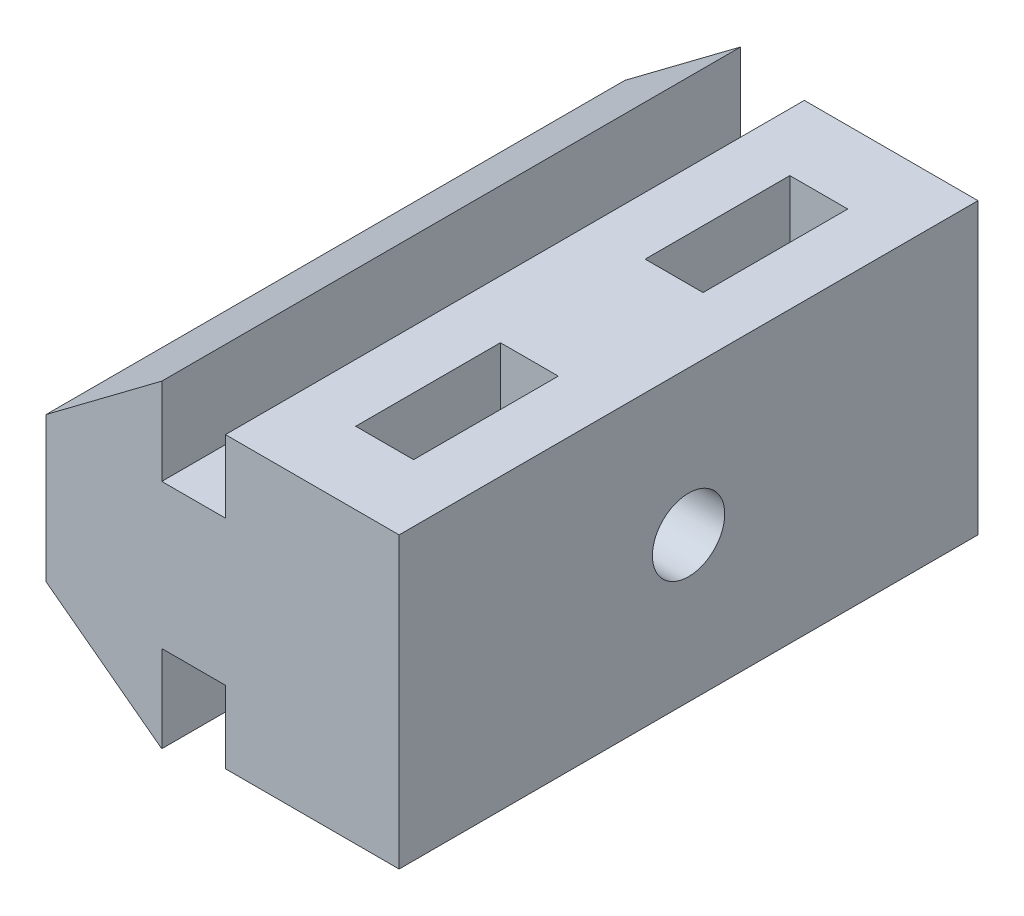
from build123d import *

# Parameters (mm, degrees)
BOSS_EXTRU_1_DEPTH      = 20
ESQUISSE1_R             = 1.25
ENL_V_MAT_EXTRU_1_DEPTH = 25.755605426
ESQUISSE2_W             = 2
ESQUISSE2_H             = 5
ENL_V_MAT_EXTRU_2_DEPTH = 26.672748197


with BuildPart() as part:
    # ProfileRainureEsquisse → Boss.-Extru.1 (new body)
    with BuildSketch(Plane.XY):
        Polygon((0, 0), (0, 5), (4, 8), (4, 5), (6.2, 5), (6.2, 7.5), (12.2, 7.5), (12.2, -2.5), (6.2, -2.5), (6.2, 0), (4, 0), (4, -3), align=None)
    extrude(amount=BOSS_EXTRU_1_DEPTH)

    # Esquisse1 → Enlèv. mat.-Extru.1 (cut, through all)
    with BuildSketch(Plane(origin=(12.2, 0, 0), x_dir=(0, 0, -1), z_dir=(1, 0, 0))):
        with Locations((-10, 2.5)):
            Circle(ESQUISSE1_R)
    extrude(amount=-ENL_V_MAT_EXTRU_1_DEPTH, mode=Mode.SUBTRACT)

    # Esquisse2 → Enlèv. mat.-Extru.2 (cut, through all)
    with BuildSketch(Plane(origin=(0, 7.5, 0), x_dir=(1, 0, 0), z_dir=(0, 1, 0))):
        with Locations((9.2, -15)):
            Rectangle(ESQUISSE2_W, ESQUISSE2_H)
        with Locations((9.2, -5)):
            Rectangle(ESQUISSE2_W, ESQUISSE2_H)
    extrude(amount=-ENL_V_MAT_EXTRU_2_DEPTH, mode=Mode.SUBTRACT)


solid = part.part
